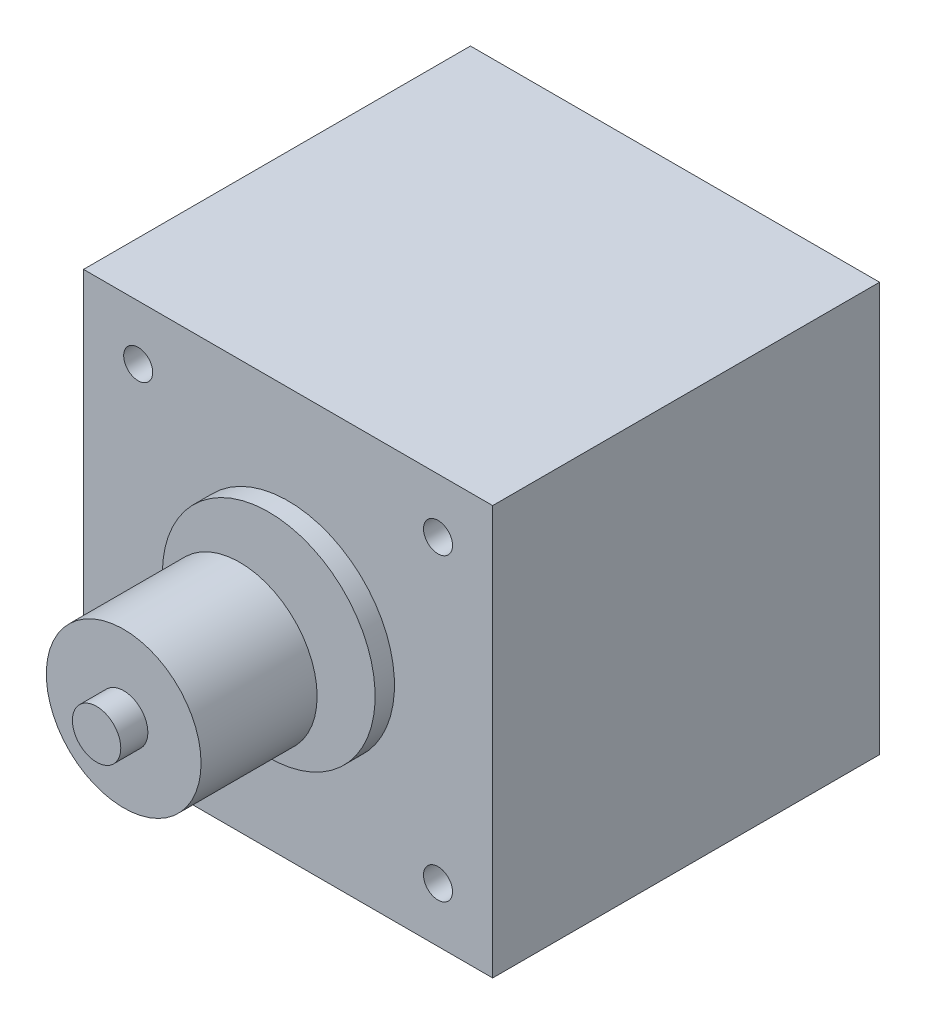
from build123d import *

# Parameters (mm, degrees)
SKETCH_1_W          = 42.3
SKETCH_1_H          = 42.3
EXTRUDE_1339_DEPTH  = 40
SKETCH_2_R          = 2.5
EXTRUDE_1394_DEPTH  = 59.8
SKETCH_3_R          = 11
EXTRUDE_1441_DEPTH  = 42
EXTRUDE_START       = 45
SKETCH_4_R          = 8
EXTRUDE_1487_DEPTH  = 12
CUT_EXTRUDE_START   = 40
SKETCH_5_R          = 1.5
CUT_EXTRUDE_3_DEPTH = 4.5


with BuildPart() as part:
    # Эскиз1 → Extrude 1339 (new body)
    with BuildSketch(Plane.XY):
        Rectangle(SKETCH_1_W, SKETCH_1_H)
    extrude(amount=EXTRUDE_1339_DEPTH)

    # Эскиз2 → Extrude 1394 (add)
    with BuildSketch(Plane.XY):
        Circle(SKETCH_2_R)
    extrude(amount=EXTRUDE_1394_DEPTH)

    # Эскиз3 → Extrude 1441 (add)
    with BuildSketch(Plane.XY):
        Circle(SKETCH_3_R)
    extrude(amount=EXTRUDE_1441_DEPTH)

    # Эскиз4 → Extrude 1487 (add)
    with BuildSketch(Plane.XY.offset(EXTRUDE_START)):
        Circle(SKETCH_4_R)
    extrude(amount=EXTRUDE_1487_DEPTH)

    # Эскиз5 → Крепеж_М3_ПРЕДВ (cut)
    with BuildSketch(Plane.XY.offset(CUT_EXTRUDE_START)):
        with Locations((-15.5, -15.5)):
            Circle(SKETCH_5_R)
        with Locations((-15.5, 15.5)):
            Circle(SKETCH_5_R)
        with Locations((15.5, -15.5)):
            Circle(SKETCH_5_R)
        with Locations((15.5, 15.5)):
            Circle(SKETCH_5_R)
    extrude(amount=-CUT_EXTRUDE_3_DEPTH, mode=Mode.SUBTRACT)


solid = part.part
